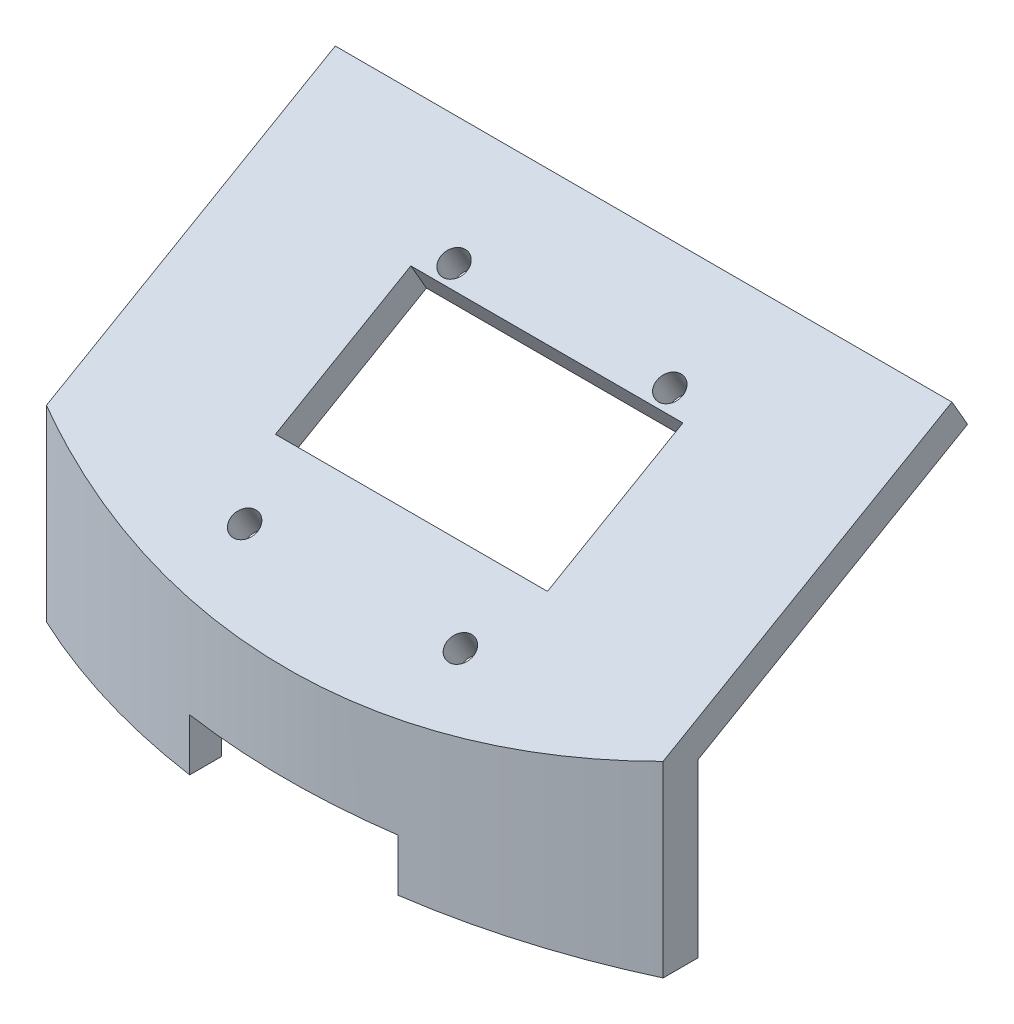
from build123d import *

# Parameters (mm, degrees)
BOSS_EXTRUDE1_DEPTH     = 18
BOSS_EXTRUDE2_DEPTH     = 3
CUT_EXTRUDE3_DEPTH      = 84.253650708
CUT_EXTRUDE3_DEPTH_BACK = 84.253650708
CUT_EXTRUDE4_DEPTH      = 84.253650708
SKETCH5_R               = 1.25
SKETCH5_W               = 26.1
SKETCH5_H               = 15
CUT_EXTRUDE1_DEPTH      = 7
SKETCH6_W               = 20
SKETCH6_H               = 10
CUT_EXTRUDE2_DEPTH      = 84.253650708


with BuildPart() as part:
    # Sketch1 → Boss-Extrude1 (new body)
    with BuildSketch(Plane(origin=(0, 0, 0), x_dir=(1, 0, 0), z_dir=(0, 1, 0))):
        with BuildLine():
            Line((-29.583278322, -63.441545093), (-29.583278322, -60.115136561))
            ThreePointArc((-29.583278322, -60.115136561), (0, -67), (29.583278322, -60.115136561))
            Line((29.583278322, -60.115136561), (29.583278322, -63.441545093))
            ThreePointArc((29.583278322, -63.441545093), (0, -70), (-29.583278322, -63.441545093))
        make_face()
    extrude(amount=BOSS_EXTRUDE1_DEPTH)

    # Sketch3 → Boss-Extrude2 (add)
    with BuildSketch(Plane(origin=(0, 40.970994853, 23.654614907), x_dir=(-1, 0, 0), z_dir=(-1.9937140685199517e-15, -0.8660254037844395, -0.49999999999999856))):
        Polygon((29.583278322, -45.941989705), (29.583278322, -13.941989705), (-29.583278322, -13.941989705), (-29.583278322, -45.941989705), (-29.583278322, -53.515041118), (29.583278322, -53.515041118), align=None)
    extrude(amount=BOSS_EXTRUDE2_DEPTH)

    # Sketch7 → Cut-Extrude3 (cut, two sides: drawn at the far end of the back side and taken through both)
    with BuildSketch(Plane(origin=(0, 0, 0), x_dir=(0, 0, -1), z_dir=(1, 0, 0)).offset(-CUT_EXTRUDE3_DEPTH_BACK)):
        Polygon((-70, 14.213474294), (-63.441545093, 18), (-70, 18), align=None)
    extrude(amount=CUT_EXTRUDE3_DEPTH + CUT_EXTRUDE3_DEPTH_BACK, mode=Mode.SUBTRACT)

    # Sketch8 → Cut-Extrude4 (cut, through all)
    with BuildSketch(Plane.XZ):
        with BuildLine():
            Line((-29.583278322, 63.441545093), (-29.583278322, 71.549825609))
            Line((-29.583278322, 71.549825609), (29.583278322, 71.549825609))
            Line((29.583278322, 71.549825609), (29.583278322, 63.441545093))
            ThreePointArc((29.583278322, 63.441545093), (0, 70), (-29.583278322, 63.441545093))
        make_face()
    extrude(amount=-CUT_EXTRUDE4_DEPTH, mode=Mode.SUBTRACT)

    # Sketch5 → Cut-Extrude1 (cut)
    with BuildSketch(Plane(origin=(0, 40.970994853, 23.654614907), x_dir=(1, 0, 0), z_dir=(2.043368544588286e-15, 0.8660254037844396, 0.4999999999999985))):
        with Locations((-10.35, -22.991989705)):
            Circle(SKETCH5_R)
        with Locations((10.35, -22.991989705)):
            Circle(SKETCH5_R)
        with Locations((10.35, -46.191989705)):
            Circle(SKETCH5_R)
        with Locations((-10.35, -46.191989705)):
            Circle(SKETCH5_R)
        with Locations((0, -32.161989705)):
            Rectangle(SKETCH5_W, SKETCH5_H)
    extrude(amount=-CUT_EXTRUDE1_DEPTH, mode=Mode.SUBTRACT)

    # Sketch6 → Cut-Extrude2 (cut, through all)
    with BuildSketch(Plane.XY):
        Rectangle(SKETCH6_W, SKETCH6_H)
    extrude(amount=CUT_EXTRUDE2_DEPTH, mode=Mode.SUBTRACT)


solid = part.part
